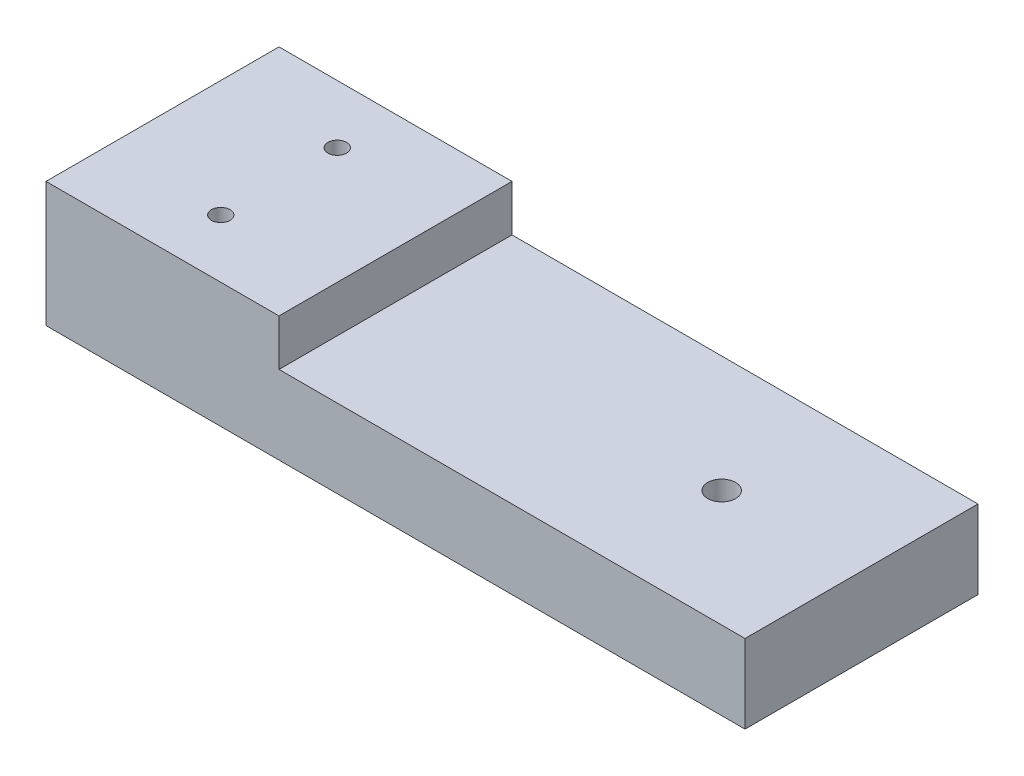
from build123d import *

# Parameters (mm, degrees)
SKETCH1_W           = 50
SKETCH1_H           = 50
BOSS_EXTRUDE1_DEPTH = 26.8
SKETCH1_3_W         = 100
SKETCH1_3_H         = 50
BOSS_EXTRUDE2_DEPTH = 16.85
SKETCH2_R           = 2
SKETCH2_R_2         = 3
CUT_EXTRUDE1_DEPTH  = 161.369074325


with BuildPart() as part:
    # Sketch1 → Boss-Extrude1 (new body)
    with BuildSketch(Plane(origin=(0, 0, 0), x_dir=(1, 0, 0), z_dir=(0, 1, 0))):
        with Locations((25, 25)):
            Rectangle(SKETCH1_W, SKETCH1_H)
    extrude(amount=BOSS_EXTRUDE1_DEPTH)

    # Sketch1<3> → Boss-Extrude2 (add)
    with BuildSketch(Plane(origin=(0, 0, 0), x_dir=(1, 0, 0), z_dir=(0, 1, 0))):
        with Locations((100, 25)):
            Rectangle(SKETCH1_3_W, SKETCH1_3_H)
    extrude(amount=BOSS_EXTRUDE2_DEPTH)

    # Sketch2 → Cut-Extrude1 (cut, through all)
    with BuildSketch(Plane.XZ):
        with Locations((25, -37.5)):
            Circle(SKETCH2_R)
        with Locations((25, -12.5)):
            Circle(SKETCH2_R)
        with Locations((120, -25)):
            Circle(SKETCH2_R_2)
    extrude(amount=-CUT_EXTRUDE1_DEPTH, mode=Mode.SUBTRACT)


solid = part.part
